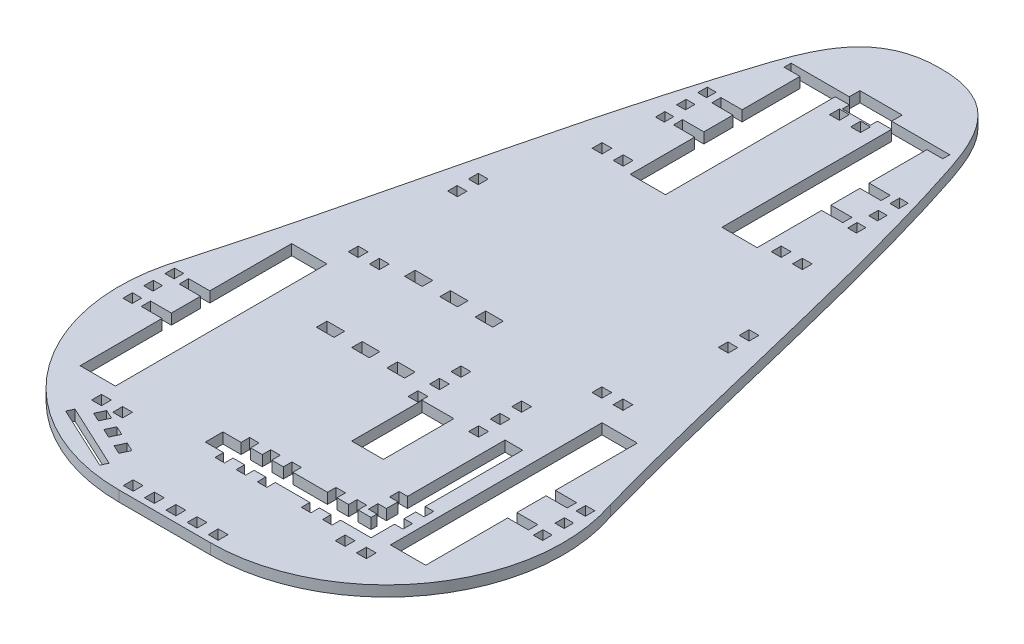
from build123d import *

# Parameters (mm, degrees)
SKETCH1_W           = 2.8
SKETCH1_H           = 2.8
SKETCH1_W_2         = 2.6
SKETCH1_H_2         = 2.7
SKETCH1_W_3         = 9
SKETCH1_H_3         = 20
SKETCH1_W_4         = 5
SKETCH1_H_4         = 3
SKETCH1_W_5         = 2.800000003
SKETCH1_H_5         = 2.800000033
SKETCH1_W_6         = 2.5
BOSS_EXTRUDE1_DEPTH = 3


with BuildPart() as part:
    # Sketch1 → Boss-Extrude1 (new body)
    with BuildSketch(Plane(origin=(0, 0, 0), x_dir=(1, 0, 0), z_dir=(0, 1, 0))):
        with BuildLine():
            ThreePointArc((-5.451969076, 56.808090366), (1.269225049, 11.62725769), (41.903463566, -9.237563228))
            Line((41.903463566, -9.237563228), (44.871962116, -9.237563228))
            Line((44.871962116, -9.237563228), (54.871962116, -9.237563228))
            Line((54.871962116, -9.237563228), (64.871962116, -9.237563228))
            Line((64.871962116, -9.237563228), (67.840460666, -9.237563228))
            ThreePointArc((67.840460666, -9.237563228), (108.474699183, 11.62725769), (115.195893308, 56.808090366))
            add(Edge.make_bspline(
                [(54.871962116, 210.762436772), (55.761906852, 210.762436772), (73.060865099, 210.353018408), (83.092194704, 181.760767183), (97.272210523, 130.317754958), (107.073403522, 85.556994311), (115.195893308, 56.808090366)],
                knots=[0, 0, 0, 0, 0.011071987, 0.221439743, 0.460221347, 1, 1, 1, 1], degree=3))
            add(Edge.make_bspline(
                [(54.871962116, 210.762436772), (53.98201738, 210.762436772), (36.683059133, 210.353018408), (26.651729528, 181.760767183), (12.471713709, 130.317754958), (2.67052071, 85.556994311), (-5.451969076, 56.808090366)],
                knots=[0, 0, 0, 0, 0.011071987, 0.221439743, 0.460221347, 1, 1, 1, 1], degree=3))
        make_face()
        Polygon((33.080876842, -5.878907781), (14.954721124, 2.573457502), (15.799957652, 4.386073074), (33.92611337, -4.066292209), align=None, mode=Mode.SUBTRACT)
        Polygon((30.345221508, 0.913638862), (31.528552648, 3.451300662), (34.066214448, 2.267969523), (32.882883308, -0.269692278), align=None, mode=Mode.SUBTRACT)
        Polygon((24.907374792, 3.449348447), (26.090705932, 5.987010247), (28.628367733, 4.803679108), (27.445036593, 2.266017307), align=None, mode=Mode.SUBTRACT)
        Polygon((19.469528077, 5.985058032), (20.652859217, 8.522719832), (23.190521017, 7.339388693), (22.007189878, 4.801726892), align=None, mode=Mode.SUBTRACT)
        with Locations((17.32012911, 10.362436772)):
            Rectangle(SKETCH1_W, SKETCH1_H, mode=Mode.SUBTRACT)
        with Locations((23.32012911, 10.362436772)):
            Rectangle(SKETCH1_W, SKETCH1_H, mode=Mode.SUBTRACT)
        with Locations((42.821962116, -6.137563566)):
            Rectangle(SKETCH1_W, SKETCH1_H, mode=Mode.SUBTRACT)
        with Locations((48.821962116, -6.137563566)):
            Rectangle(SKETCH1_W, SKETCH1_H, mode=Mode.SUBTRACT)
        with Locations((54.921962116, -6.137563566)):
            Rectangle(SKETCH1_W, SKETCH1_H, mode=Mode.SUBTRACT)
        with Locations((60.921962116, -6.137563566)):
            Rectangle(SKETCH1_W, SKETCH1_H, mode=Mode.SUBTRACT)
        with Locations((66.921962116, -6.137563566)):
            Rectangle(SKETCH1_W, SKETCH1_H, mode=Mode.SUBTRACT)
        with Locations((86.423795122, 10.362436772)):
            Rectangle(SKETCH1_W, SKETCH1_H, mode=Mode.SUBTRACT)
        with Locations((92.423795122, 10.362436772)):
            Rectangle(SKETCH1_W, SKETCH1_H, mode=Mode.SUBTRACT)
        with Locations((-3.328903903, 39.762436772)):
            Rectangle(SKETCH1_W_2, SKETCH1_H_2, mode=Mode.SUBTRACT)
        with Locations((-3.428037884, 45.762436772)):
            Rectangle(SKETCH1_W_2, SKETCH1_H_2, mode=Mode.SUBTRACT)
        with Locations((-3.428037884, 51.762436772)):
            Rectangle(SKETCH1_W_2, SKETCH1_H_2, mode=Mode.SUBTRACT)
        Polygon((5.871962116, 52.537436772), (5.871962116, 75.762436772), (15.871962116, 75.762436772), (15.871962116, 15.762436772), (5.871962116, 15.762436772), (5.871962116, 38.987435395), (-0.028903903, 38.987435395), (-0.028903903, 41.637435395), (5.871962116, 41.637435395), (5.871962116, 49.887436772), (-0.128037884, 49.887436772), (-0.128037884, 52.537436772), align=None, mode=Mode.SUBTRACT)
        Polygon((80.721962116, 19.762436772), (84.371962116, 19.762436772), (84.371962116, 21.412436772), (81.971962116, 21.412436772), (81.971962116, 24.112436772), (84.371962116, 24.112436772), (84.371962116, 27.412436772), (81.971962116, 27.412436772), (81.971962116, 30.112436772), (84.371962116, 30.112436772), (84.371962116, 57.762436772), (89.371962116, 57.762436772), (89.371962116, 30.112436772), (91.771962116, 30.112436772), (91.771962116, 27.412436772), (89.371962116, 27.412436772), (89.371962116, 24.112436772), (91.771962116, 24.112436772), (91.771962116, 21.412436772), (89.371962116, 21.412436772), (89.371962116, 19.762436772), (89.371962116, 14.762436772), (84.371962116, 14.762436772), (80.721962116, 14.762436772), (80.721962116, 12.362436772), (78.021962116, 12.362436772), (78.021962116, 14.762436772), (74.721962116, 14.762436772), (74.721962116, 12.362436772), (72.021962116, 12.362436772), (72.021962116, 14.762436772), (62.221962161, 14.762436772), (62.221962116, 12.362436772), (59.521962116, 12.362436772), (59.521962161, 14.762436772), (56.221962161, 14.762436772), (56.221962116, 12.362436772), (53.521962116, 12.362436772), (53.521962116, 14.762436772), (50.221962116, 14.762436772), (50.221962116, 12.362436772), (47.521962116, 12.362436772), (47.521962116, 14.762436772), (42.371962116, 14.762436772), (42.371962116, 19.762436772), (47.521962116, 19.762436772), (47.521962116, 22.162436772), (50.221962116, 22.162436772), (50.221962116, 19.762436772), (53.521962116, 19.762436772), (53.521962116, 22.162436772), (56.221962116, 22.162436772), (56.221962161, 19.762436772), (59.521962161, 19.762436772), (59.521962116, 22.162436772), (62.221962116, 22.162436772), (62.221962161, 19.762436772), (72.021962116, 19.762436772), (72.021962116, 22.162436772), (74.721962116, 22.162436772), (74.721962116, 19.762436772), (78.021962116, 19.762436772), (78.021962116, 22.162436772), (80.721962116, 22.162436772), align=None, mode=Mode.SUBTRACT)
        with Locations((67.371962116, 45.762436772)):
            Rectangle(SKETCH1_W_3, SKETCH1_H_3, mode=Mode.SUBTRACT)
        with Locations((32.421095947, 60.217167702)):
            Rectangle(SKETCH1_W_4, SKETCH1_H_4, mode=Mode.SUBTRACT)
        with Locations((17.32012911, 83.162436772)):
            Rectangle(SKETCH1_W, SKETCH1_H, mode=Mode.SUBTRACT)
        with Locations((23.32012911, 83.162436772)):
            Rectangle(SKETCH1_W, SKETCH1_H, mode=Mode.SUBTRACT)
        with Locations((42.421095947, 60.217167702)):
            Rectangle(SKETCH1_W_4, SKETCH1_H_4, mode=Mode.SUBTRACT)
        with Locations((52.421095947, 60.217167702)):
            Rectangle(SKETCH1_W_4, SKETCH1_H_4, mode=Mode.SUBTRACT)
        with Locations((61.321095984, 56.117167438)):
            Rectangle(SKETCH1_W, SKETCH1_H, mode=Mode.SUBTRACT)
        with Locations((61.321095986, 62.217167405)):
            Rectangle(SKETCH1_W_5, SKETCH1_H, mode=Mode.SUBTRACT)
        with Locations((61.321095986, 68.317167422)):
            Rectangle(SKETCH1_W_5, SKETCH1_H_5, mode=Mode.SUBTRACT)
        with Locations((113.072828135, 39.762436772)):
            Rectangle(SKETCH1_W_2, SKETCH1_H_2, mode=Mode.SUBTRACT)
        Polygon((103.871962116, 38.987435395), (103.871962116, 15.762436772), (93.871962116, 15.762436772), (93.871962116, 75.762436772), (103.871962116, 75.762436772), (103.871962116, 52.537436772), (109.871962116, 52.537436772), (109.871962116, 49.887436772), (103.871962116, 49.887436772), (103.871962116, 41.637435395), (109.772828135, 41.637435395), (109.772828135, 38.987435395), align=None, mode=Mode.SUBTRACT)
        with Locations((113.171962116, 45.762436772)):
            Rectangle(SKETCH1_W_2, SKETCH1_H_2, mode=Mode.SUBTRACT)
        with Locations((113.171962116, 51.762436772)):
            Rectangle(SKETCH1_W_2, SKETCH1_H_2, mode=Mode.SUBTRACT)
        with Locations((78.521095987, 56.117167438)):
            Rectangle(SKETCH1_W, SKETCH1_H, mode=Mode.SUBTRACT)
        with Locations((78.521095987, 62.217167405)):
            Rectangle(SKETCH1_W, SKETCH1_H, mode=Mode.SUBTRACT)
        with Locations((78.521095987, 68.317167422)):
            Rectangle(SKETCH1_W, SKETCH1_H_5, mode=Mode.SUBTRACT)
        with Locations((86.423795122, 83.162436772)):
            Rectangle(SKETCH1_W, SKETCH1_H, mode=Mode.SUBTRACT)
        with Locations((92.423795122, 83.162436772)):
            Rectangle(SKETCH1_W, SKETCH1_H, mode=Mode.SUBTRACT)
        with Locations((32.421095947, 85.217167702)):
            Rectangle(SKETCH1_W_4, SKETCH1_H_4, mode=Mode.SUBTRACT)
        with Locations((16.471962116, 112.112436772)):
            Rectangle(SKETCH1_W, SKETCH1_H_2, mode=Mode.SUBTRACT)
        with Locations((42.421095947, 85.217167702)):
            Rectangle(SKETCH1_W_4, SKETCH1_H_4, mode=Mode.SUBTRACT)
        with Locations((52.421095947, 85.217167702)):
            Rectangle(SKETCH1_W_4, SKETCH1_H_4, mode=Mode.SUBTRACT)
        with Locations((16.472928849, 118.062436772)):
            Rectangle(SKETCH1_W, SKETCH1_H, mode=Mode.SUBTRACT)
        with Locations((26.471962116, 143.162922974)):
            Rectangle(SKETCH1_W, SKETCH1_H, mode=Mode.SUBTRACT)
        with Locations((32.471962116, 143.162436772)):
            Rectangle(SKETCH1_W, SKETCH1_H, mode=Mode.SUBTRACT)
        with Locations((93.271962116, 112.112436772)):
            Rectangle(SKETCH1_W, SKETCH1_H_2, mode=Mode.SUBTRACT)
        with Locations((93.270995383, 118.062436772)):
            Rectangle(SKETCH1_W, SKETCH1_H, mode=Mode.SUBTRACT)
        with Locations((77.271962116, 143.162436772)):
            Rectangle(SKETCH1_W, SKETCH1_H, mode=Mode.SUBTRACT)
        with Locations((83.271962116, 143.162922974)):
            Rectangle(SKETCH1_W, SKETCH1_H, mode=Mode.SUBTRACT)
        with Locations((27.621962116, 159.762436772)):
            Rectangle(SKETCH1_W_6, SKETCH1_H_2, mode=Mode.SUBTRACT)
        with Locations((27.621962116, 165.762436772)):
            Rectangle(SKETCH1_W_6, SKETCH1_H_2, mode=Mode.SUBTRACT)
        with Locations((27.621962116, 171.762436772)):
            Rectangle(SKETCH1_W_6, SKETCH1_H_2, mode=Mode.SUBTRACT)
        Polygon((36.871962116, 172.487436772), (36.871962116, 188.883995744), (32.371962116, 188.883995744), (32.371962116, 190.883995744), (48.871962116, 190.883995744), (48.871962116, 193.883995744), (60.871962116, 193.883995744), (60.871962116, 190.883995744), (77.371962116, 190.883995744), (77.371962116, 188.883995744), (72.871962116, 188.883995744), (72.871962116, 172.487436772), (78.871962116, 172.487436772), (78.871962116, 169.887436772), (72.871962116, 169.887436772), (72.871962116, 161.637436772), (78.871962116, 161.637436772), (78.871962116, 159.037436772), (72.871962116, 159.037436772), (72.871962116, 140.762436772), (62.871962116, 140.762436772), (62.871962116, 188.883995744), (58.871962116, 188.883995744), (58.871962116, 186.883995744), (50.871962116, 186.883995744), (50.871962116, 188.883995744), (46.871962116, 188.883995744), (46.871962116, 140.762436772), (36.871962116, 140.762436772), (36.871962116, 159.037436772), (30.871962116, 159.037436772), (30.871962116, 161.637436772), (36.871962116, 161.637436772), (36.871962116, 169.887436772), (30.871962116, 169.887436772), (30.871962116, 172.487436772), align=None, mode=Mode.SUBTRACT)
        Polygon((50.471962116, 183.679368755), (50.473853304, 186.479368116), (53.271962116, 186.479368755), (53.271962116, 183.679368755), align=None, mode=Mode.SUBTRACT)
        Polygon((56.471962116, 183.679368755), (56.471962116, 186.479368755), (59.270070928, 186.479368116), (59.271962116, 183.679368755), align=None, mode=Mode.SUBTRACT)
        with Locations((82.121962116, 159.762436772)):
            Rectangle(SKETCH1_W_6, SKETCH1_H_2, mode=Mode.SUBTRACT)
        with Locations((82.121962116, 165.762436772)):
            Rectangle(SKETCH1_W_6, SKETCH1_H_2, mode=Mode.SUBTRACT)
        with Locations((82.121962116, 171.762436772)):
            Rectangle(SKETCH1_W_6, SKETCH1_H_2, mode=Mode.SUBTRACT)
    extrude(amount=BOSS_EXTRUDE1_DEPTH)


solid = part.part
